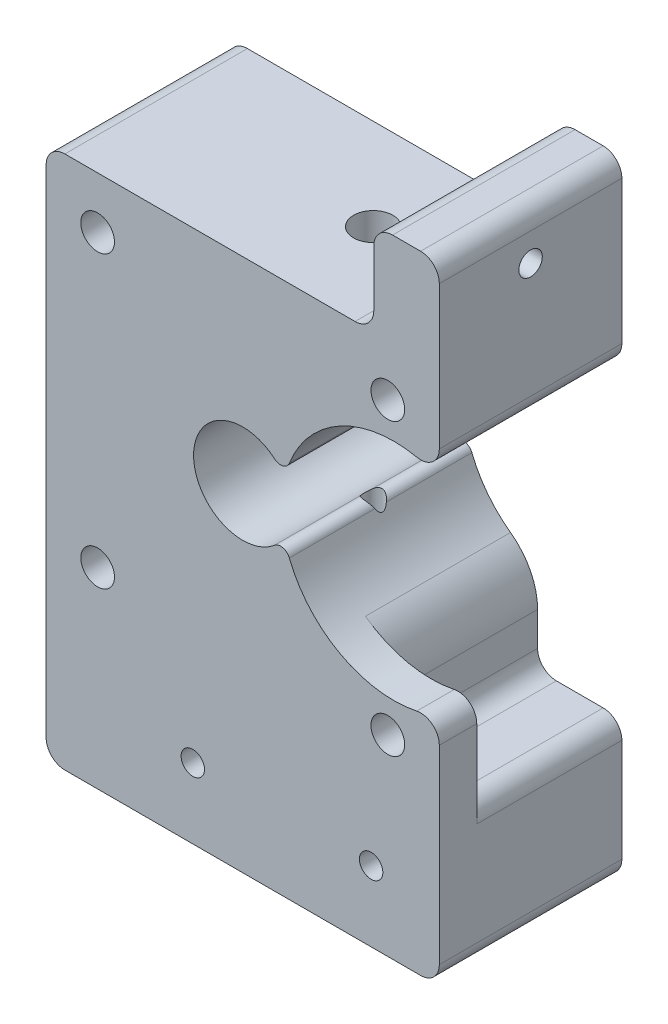
from build123d import *

# Parameters (mm, degrees)
BOSS_EXTRUDE1_DEPTH       = 19.5
SKETCH2_R                 = 5.25
HOBB_CLEARANCE_DEPTH      = 22
M3_CLEARANCE_HOLE1_D      = 3.6
SKETCH6_R                 = 12
CUT_EXTRUDE2_DEPTH        = 22
CUT_EXTRUDE3_START        = 15.5
CUT_EXTRUDE3_DEPTH        = 15.5
M3X0_5_TAPPED_HOLE1_D     = 2.5
FILLET1_R                 = 1
M5X0_8_TAPPED_HOLE1_D     = 4.2
M5X0_8_TAPPED_HOLE1_DEPTH = 21
M5X0_8_TAPPED_HOLE1_TIP   = 1.2618073
SKETCH12_R                = 1
CUT_EXTRUDE4_DEPTH        = 51.845353932
BOSS_EXTRUDE2_DEPTH       = 15
BOSS_EXTRUDE2_DEPTH_BACK  = 0.005
SKETCH14_W                = 42
SKETCH14_H                = 19.5
SKETCH15_R                = 1
CUT_EXTRUDE6_DEPTH        = 26.51413021
CUT_EXTRUDE7_START        = -2
CUT_EXTRUDE7_DEPTH        = 11
M3X0_5_TAPPED_HOLE2_D     = 2.5
FILLET3_R                 = 2
CHAMFER2_SIZE             = 1
CHAMFER2_SIZE2            = 1.732050808
FILLET4_START             = -1
FILLET4_DEPTH             = 16.5


with BuildPart() as part:
    # Sketch1 → Boss-Extrude1 (new body)
    with BuildSketch(Plane.XY):
        Polygon((21, -21), (21, 31), (14, 31), (14, 21), (-21, 21), (-21, -21), align=None)
    extrude(amount=BOSS_EXTRUDE1_DEPTH)

    # Sketch2 → Hobb Clearance (cut)
    with BuildSketch(Plane.XY.offset(19.5)):
        Circle(SKETCH2_R)
    extrude(amount=-HOBB_CLEARANCE_DEPTH, mode=Mode.SUBTRACT)

    # M3 Clearance Hole1 (through all)
    with Locations(Plane.XY.offset(19.5)):
        with Locations((-15.5, 15.5), (15.5, 15.5), (15.5, -15.5), (-15.5, -15.5)):
            Hole(M3_CLEARANCE_HOLE1_D / 2)

    # Sketch6 → Cut-Extrude2 (cut)
    with BuildSketch(Plane.XY.offset(19.5)):
        with Locations((16.1475, 0)):
            Circle(SKETCH6_R)
    extrude(amount=-CUT_EXTRUDE2_DEPTH, mode=Mode.SUBTRACT)

    # Sketch7 → Cut-Extrude3 (cut)
    with BuildSketch(Plane.XY.offset(CUT_EXTRUDE3_START)):
        with BuildLine():
            Line((21, -10.975119305), (21, -21))
            Line((21, -21), (12, -21))
            Line((12, -21), (12, -11.260472626))
            ThreePointArc((12, -11.260472626), (16.527780001, -11.99397295), (21, -10.975119305))
        make_face()
    extrude(amount=-CUT_EXTRUDE3_DEPTH, mode=Mode.SUBTRACT)

    # M3x0.5 Tapped Hole1 (through all)
    with Locations(Plane.ZY.offset(-14)):
        with Locations((9.75, 26)):
            Hole(M3X0_5_TAPPED_HOLE1_D / 2)

    # Fillet1
    fillet1_edges = [part.edges().sort_by_distance(p)[0] for p in [
        (4.468315722, -2.756202933, 9.75),
        (4.468315722, 2.756202933, 9.75),
    ]]
    fillet(fillet1_edges, radius=FILLET1_R)

    # M5x0.8 Tapped Hole1
    with Locations(Plane(origin=(0, 21, 0), x_dir=(1, 0, 0), z_dir=(0, 1, 0))):
        with Locations((4.191547948, -9.75)):
            Hole(M5X0_8_TAPPED_HOLE1_D / 2, depth=M5X0_8_TAPPED_HOLE1_DEPTH)
            with Locations((0, 0, -(M5X0_8_TAPPED_HOLE1_DEPTH + M5X0_8_TAPPED_HOLE1_TIP / 2))):  # 118° drill point
                Cone(0, M5X0_8_TAPPED_HOLE1_D / 2, M5X0_8_TAPPED_HOLE1_TIP, mode=Mode.SUBTRACT)

    # Sketch12 → Cut-Extrude4 (cut, through all)
    with BuildSketch(Plane(origin=(0, 21, 0), x_dir=(1, 0, 0), z_dir=(0, 1, 0))):
        with Locations(Location((4.191547948, -9.75, 0), (0, 0, 270))):
            Circle(SKETCH12_R)
    extrude(amount=-CUT_EXTRUDE4_DEPTH, mode=Mode.SUBTRACT)

    # Sketch14 → Boss-Extrude2 (add, two sides: drawn at the far end of the back side and taken through both)
    with BuildSketch(Plane.XZ.offset(21).offset(-BOSS_EXTRUDE2_DEPTH_BACK)):
        with Locations((0, 9.75)):
            Rectangle(SKETCH14_W, SKETCH14_H)
    extrude(amount=BOSS_EXTRUDE2_DEPTH + BOSS_EXTRUDE2_DEPTH_BACK)

    # Sketch15 → Cut-Extrude6 (cut)
    with BuildSketch(Plane(origin=(0, -20.995, 0), x_dir=(1, 0, 0), z_dir=(0, 1, 0))):
        with Locations(Location((4.191547948, -9.75, 0), (0, 0, 322.12020771))):
            Circle(SKETCH15_R)
    extrude(amount=-CUT_EXTRUDE6_DEPTH, mode=Mode.SUBTRACT)

    # Sketch16 → Cut-Extrude7 (cut)
    with BuildSketch(Plane(origin=(0, -20.995, 0), x_dir=(1, 0, 0), z_dir=(0, 1, 0)).offset(CUT_EXTRUDE7_START)):
        Polygon((-17.558452052, -1.75), (-9.058452052, -1.75), (-9.058452052, -3.75), (-8.058452052, -3.75), (-2.558452052, -3.75), (-2.558452052, -12.75), (2.691547948, -12.75), (5.691547948, -12.75), (10.941547948, -12.75), (10.941547948, -3.75), (16.441547948, -3.75), (17.441547948, -3.75), (17.441547948, 0), (-17.558452052, 0), (-17.558452052, -0.75), align=None)
    extrude(amount=-CUT_EXTRUDE7_DEPTH, mode=Mode.SUBTRACT)

    # M3x0.5 Tapped Hole2 (through all)
    with Locations(Plane(origin=(0, 0, 3.75), x_dir=(-1, 0, 0), z_dir=(0, 0, -1))):
        with Locations((5.333452052, -28.495), (-13.716547948, -28.495)):
            Hole(M3X0_5_TAPPED_HOLE2_D / 2)

    # Chamfer1: read off the stored shape, not the designer's step
    # Chamfer1 outline → Chamfer1 (revolve, cut)
    with BuildSketch(Plane(origin=(4.191547948, 0, 9.75), x_dir=(1, 0, 0), z_dir=(0, 0, 1))):
        Polygon((3, -22.995), (1, -19.530898385), (1, -22.995), align=None)
    revolve(axis=Axis((4.191547948, 0, 9.75), (0, 1, 0)), mode=Mode.SUBTRACT)

    # Fillet3
    fillet3_edges = [part.edges().sort_by_distance(p)[0] for p in [
        (21, -20.995, 7.75),
        (12, -20.995, 7.75),
        (-21, -36, 9.75),
        (21, -36, 9.75),
        (-21, 21, 9.75),
        (21, 10.975119305, 9.75),
        (21, -10.975119305, 17.5),
        (12, -11.260472626, 7.75),
        (14, 31, 9.75),
        (21, 31, 9.75),
        (14, 21, 9.75),
    ]]
    fillet(fillet3_edges, radius=FILLET3_R)

    # Chamfer2
    chamfer2_edges = [part.edges().sort_by_distance(p)[0] for p in [
        (3.40224726, -36, 9.135993141),
    ]]
    chamfer2_side = [part.faces().sort_by_distance(p)[0] for p in [
        (3.40224726, -34.9975, 9.135993141),
    ]]
    chamfer(chamfer2_edges, length=CHAMFER2_SIZE, length2=CHAMFER2_SIZE2, reference=chamfer2_side[0])

    # Fillet4: read off the stored shape, not the designer's step
    # Fillet4 outline → Fillet4 (cut)
    with BuildSketch(Plane.XY.offset(FILLET4_START)):
        with BuildLine():
            ThreePointArc((9.106973684, -9.717560867), (11.234934474, -12.204064485), (12, -15.386138039))
            Line((12, -15.386138039), (12, -12.578085854))
            ThreePointArc((12, -12.578085854), (11.696530072, -11.518941995), (10.878214286, -10.781216446))
            ThreePointArc((10.878214286, -10.781216446), (9.969659856, -10.28757946), (9.106973684, -9.717560867))
        make_face()
    extrude(amount=FILLET4_DEPTH, mode=Mode.SUBTRACT)


solid = part.part
